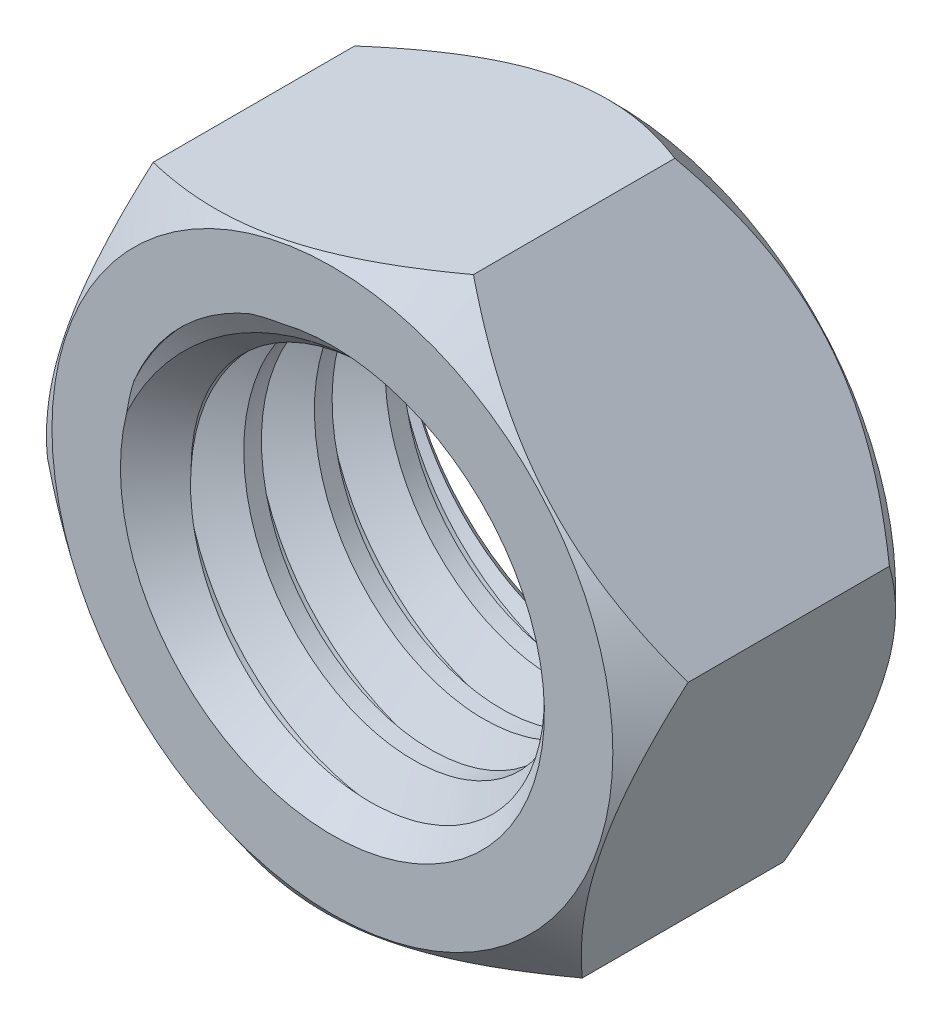
from build123d import *

# Parameters (mm, degrees)
RESSALTO_EXTRUS_O1_DEPTH = 4
FURO_ROSCADO_DE_M61_D    = 5
CHANFRO1_SIZE            = 0.5
ROSCA1_PITCH             = 1


with BuildPart() as part:
    # Esboço1 → Ressalto-extrusão1 (new body)
    with BuildSketch(Plane.XY):
        Polygon((3.036631219, -3.480259211), (4.532308498, 0.889670172), (1.495677279, 4.369929383), (-3.036631219, 3.480259211), (-4.532308498, -0.889670172), (-1.495677279, -4.369929383), align=None)
    extrude(amount=RESSALTO_EXTRUS_O1_DEPTH)

    # Furo roscado de M61 (through all)
    with Locations(Plane.XY.offset(4)):
        with Locations((0, 0)):
            Hole(FURO_ROSCADO_DE_M61_D / 2)

    # Chanfro1
    chanfro1_edges = [part.edges().sort_by_distance(p)[0] for p in [
        (2.5, 0, 4),
        (2.5, 0, 0),
    ]]
    chamfer(chanfro1_edges, length=CHANFRO1_SIZE)

    # Rosca1: the profile of Perfil da rosca1 profile screwed along a right-hand helix of 5.5 turns, 8 arcs to a turn; built about Z, then put on its axis
    rosca1_z = Axis((0, 0, 0), (0, 0, 1))
    rosca1_corners = [(2.4997, 0, -0.000173205), (3.041265875, 0, 0.312499999), (3.041265875, 0, 0.437499999), (2.4997, 0, 0.750173202)]
    with BuildLine(mode=Mode.PRIVATE) as rosca1_profile:
        Line(rosca1_corners[0], rosca1_corners[1])
        Line(rosca1_corners[1], rosca1_corners[2])
        Line(rosca1_corners[2], rosca1_corners[3])
        Line(rosca1_corners[3], rosca1_corners[0])
    rosca1_cap = Face(rosca1_profile.wire())
    rosca1_turn_angles = [0, 22.5, 45, 67.5, 90, 112.5, 135, 157.5, 180, 202.5, 225, 247.5, 270, 292.5, 315, 337.5, 360]
    rosca1_turn_weights = [1, 0.9238795325112867, 1, 0.9238795325112867, 1, 0.9238795325112867, 1, 0.9238795325112867, 1, 0.9238795325112867, 1, 0.9238795325112867, 1, 0.9238795325112867, 1, 0.9238795325112867, 1]
    rosca1_turn_rails = [Edge.make_bspline([Vector(p[0], p[1], 0).rotate(rosca1_z, rosca1_turn_angles[k]) / rosca1_turn_weights[k] + Vector(0, 0, p[2] + ROSCA1_PITCH * rosca1_turn_angles[k] / 360) for k in range(17)], [0, 0, 0, 1, 1, 2, 2, 3, 3, 4, 4, 5, 5, 6, 6, 7, 7, 8, 8, 8], 2, rosca1_turn_weights) for p in rosca1_corners]
    rosca1_turn_sides = [Face.make_surface_from_curves(rosca1_turn_rails[p[0]], rosca1_turn_rails[p[1]]) for p in [(0, 1), (1, 2), (2, 3), (3, 0)]]
    rosca1_last_angles = [1800, 1822.5, 1845, 1867.5, 1890, 1912.5, 1935, 1957.5, 1980]
    rosca1_last_weights = [1, 0.9238795325112867, 1, 0.9238795325112867, 1, 0.9238795325112867, 1, 0.9238795325112867, 1]
    rosca1_last_rails = [Edge.make_bspline([Vector(p[0], p[1], 0).rotate(rosca1_z, rosca1_last_angles[k]) / rosca1_last_weights[k] + Vector(0, 0, p[2] + ROSCA1_PITCH * rosca1_last_angles[k] / 360) for k in range(9)], [0, 0, 0, 1, 1, 2, 2, 3, 3, 4, 4, 4], 2, rosca1_last_weights) for p in rosca1_corners]
    rosca1_last_sides = [Face.make_surface_from_curves(rosca1_last_rails[p[0]], rosca1_last_rails[p[1]]) for p in [(0, 1), (1, 2), (2, 3), (3, 0)]]
    rosca1 = Plane(origin=(0, 0, 4.5), x_dir=(-1, 0, 0), z_dir=(0, 0, -1)) * Solid(Shell([*[p.moved(Location((0, 0, ROSCA1_PITCH * i))) for i in range(5) for p in rosca1_turn_sides], *rosca1_last_sides, rosca1_cap, rosca1_cap.rotate(rosca1_z, 1980).moved(Location((0, 0, ROSCA1_PITCH * 1980 / 360)))]))
    add(rosca1, mode=Mode.SUBTRACT)

    # Esboço11 → Corte-Revolução1 (revolve, cut)
    with BuildSketch(Plane(origin=(0, 0, 0), x_dir=(0, 0, -1), z_dir=(0.9461174645548597, -0.3238236298732443, 0)), mode=Mode.PRIVATE) as corte_revolu_o1_sk:
        Polygon((-4, 4.618802154), (-4, 3.968802154), (-3.5, 4.618802154), align=None)
    revolve(corte_revolu_o1_sk.sketch.rotate(Axis((0, 0, 0), (0, 0, 1)), 108.894320191), axis=Axis((0, 0, 0), (0, 0, 1)), mode=Mode.SUBTRACT)

    # Esboço13 → Corte-Revolução2 (revolve, cut)
    with BuildSketch(Plane(origin=(0, 0, 0), x_dir=(0, 0, -1), z_dir=(0.9461174645548597, -0.3238236298732443, 0)), mode=Mode.PRIVATE) as corte_revolu_o2_sk:
        Polygon((0, 4.618802154), (0, 3.968802154), (-0.65, 4.618802154), align=None)
    revolve(corte_revolu_o2_sk.sketch.rotate(Axis((0, 0, 4), (0, 0, 1)), 300.000000101), axis=Axis((0, 0, 4), (0, 0, 1)), mode=Mode.SUBTRACT)


solid = part.part
